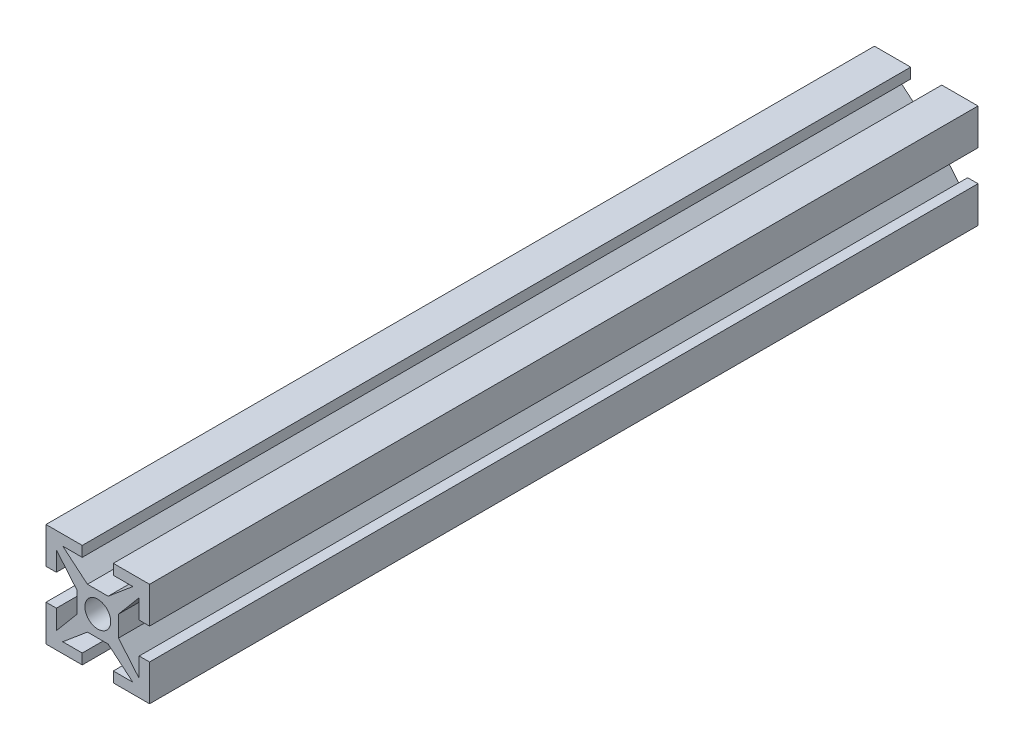
from build123d import *

# Parameters (mm, degrees)
ESQUISSE2_R          = 1.25
MAIN_EXTRUSION_DEPTH = 80


with BuildPart() as part:
    # Esquisse2 → Main Extrusion (new body)
    with BuildSketch(Plane.XY):
        Polygon((-1, -2), (1, -2), (3.383507185, -4), (1.5, -4), (1.5, -5), (5, -5), (5, -1.5), (4, -1.5), (4, -3.383507185), (2, -1), (2, 1), (4, 3.383507185), (4, 1.5), (5, 1.5), (5, 5), (1.5, 5), (1.5, 4), (3.383507185, 4), (1, 2), (-1, 2), (-3.383507185, 4), (-1.5, 4), (-1.5, 5), (-5, 5), (-5, 1.5), (-4, 1.5), (-4, 3.383507185), (-2, 1), (-2, -1), (-4, -3.383507185), (-4, -1.5), (-5, -1.5), (-5, -5), (-1.5, -5), (-1.5, -4), (-3.383507185, -4), align=None)
        Circle(ESQUISSE2_R, mode=Mode.SUBTRACT)
    extrude(amount=MAIN_EXTRUSION_DEPTH)


solid = part.part
